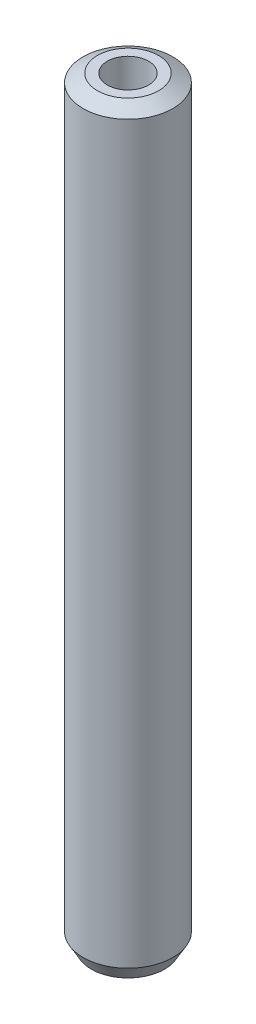
from build123d import *
from OCP.BRepFilletAPI import BRepFilletAPI_MakeChamfer

# Parameters (mm, degrees)
SKETCH1_R           = 25
BOSS_EXTRUDE1_DEPTH = 422.061469823
SKETCH2_R           = 11.513265883
CUT_EXTRUDE1_DEPTH  = 424.539708067
CHAMFER1_SIZE       = 4.598766521
CHAMFER1_SIZE2      = 7.965297266


with BuildPart() as part:
    # Sketch1 → Boss-Extrude1 (new body)
    with BuildSketch(Plane(origin=(0, 0, 0), x_dir=(1, 0, 0), z_dir=(0, 1, 0))):
        Circle(SKETCH1_R)
    extrude(amount=BOSS_EXTRUDE1_DEPTH)

    # Sketch2 → Cut-Extrude1 (cut, through all)
    with BuildSketch(Plane(origin=(0, 0, 0), x_dir=(1, 0, 0), z_dir=(0, 1, 0))):
        Circle(SKETCH2_R)
    extrude(amount=CUT_EXTRUDE1_DEPTH, mode=Mode.SUBTRACT)

    # Chamfer1: one chamfer whose edges measure the first distance from different faces: ONE call of the kernel's chamfer builder (chamfer() names one face for all edges)
    chamfer1_edges_1 = [part.edges().sort_by_distance(p)[0] for p in [
        (-25, 422.061469823, 0),
    ]]
    chamfer1_side_1 = [part.faces().sort_by_distance(p)[0] for p in [
        (-25, 211.030734912, 0),
    ]]
    chamfer1_edges_2 = [part.edges().sort_by_distance(p)[0] for p in [
        (-25, 0, 0),
    ]]
    chamfer1_side_2 = [part.faces().sort_by_distance(p)[0] for p in [
        (-24.292893219, 0, 0),
    ]]
    chamfer1 = BRepFilletAPI_MakeChamfer(part.part.solid().wrapped)
    for e in chamfer1_edges_1:
        chamfer1.Add(CHAMFER1_SIZE, CHAMFER1_SIZE2, e.wrapped, chamfer1_side_1[0].wrapped)  # the first distance lies on this face
    for e in chamfer1_edges_2:
        chamfer1.Add(CHAMFER1_SIZE, CHAMFER1_SIZE2, e.wrapped, chamfer1_side_2[0].wrapped)  # the first distance lies on this face
    add(Compound.cast(chamfer1.Shape()), mode=Mode.REPLACE)


solid = part.part
